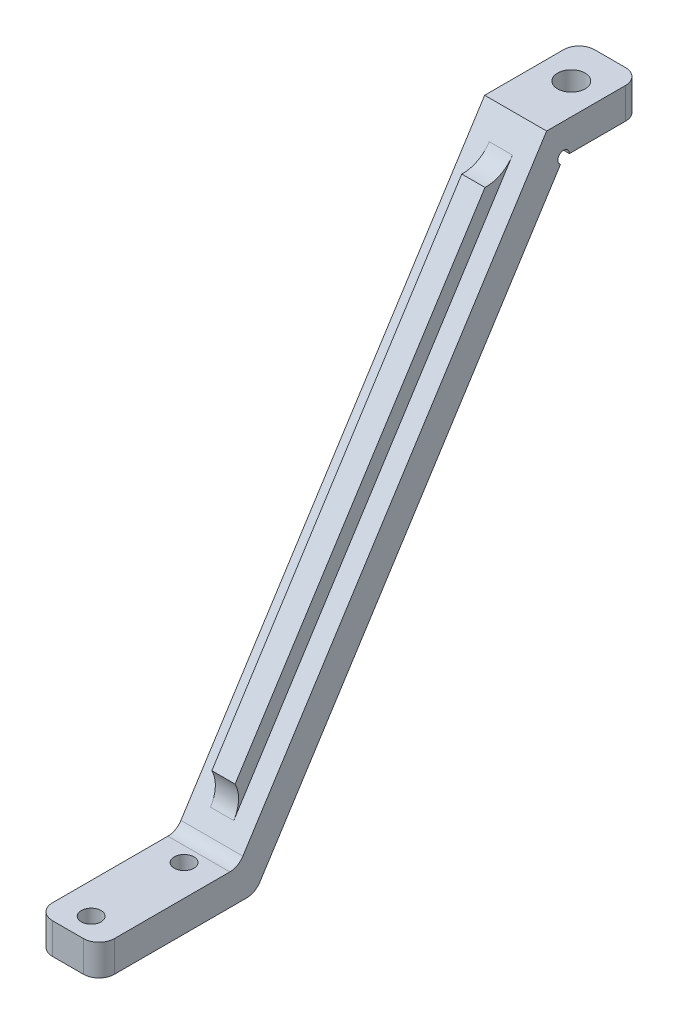
from build123d import *

# Parameters (mm, degrees)
EXTRUDE_1_DEPTH          = 4
CUT_EXTRUDE_1_DEPTH      = 82.325026898
CUT_EXTRUDE_1_DEPTH_BACK = 82.325026898
SKETCH_2_R               = 1.275
CUT_EXTRUDE_2_DEPTH      = 85.433168838
CUT_EXTRUDE_2_DEPTH_BACK = 85.433168838
SKETCH_3_R               = 1.775
EXTRUDE_2_DEPTH          = 1.5
CUT_EXTRUDE_3_DEPTH      = 82.619605488
CUT_EXTRUDE_3_DEPTH_BACK = 82.619605488
SKETCH_5_R               = 0.75
FILLET_2_R               = 4
FILLET_3_R               = 2
FILLET_4_R               = 2


with BuildPart() as part:
    # 草图1 → 凸台-拉伸1 (new, symmetric)
    with BuildSketch(Plane(origin=(0, 0, 0), x_dir=(0, 0, -1), z_dir=(1, 0, 0))):
        Polygon((-18, 0), (0, 0), (39.807123819, 62.4), (52, 62.4), (52, 58.4), (42, 58.4), (2.192876181, -4), (-18, -4), align=None)
    extrude(amount=EXTRUDE_1_DEPTH, both=True)

    # 草图2 → 切除-拉伸1 (cut, two sides: drawn at the far end of the back side and taken through both)
    with BuildSketch(Plane(origin=(0, 0, 0), x_dir=(1, 0, 0), z_dir=(0, 1, 0)).offset(-CUT_EXTRUDE_1_DEPTH_BACK)):
        with Locations(Location((0, -3, 0), (0, 0, 270))):
            Circle(SKETCH_2_R)
        with Locations(Location((0, -15, 0), (0, 0, 270))):
            Circle(SKETCH_2_R)
    extrude(amount=CUT_EXTRUDE_1_DEPTH + CUT_EXTRUDE_1_DEPTH_BACK, mode=Mode.SUBTRACT)

    # 草图3 → 切除-拉伸2 (cut, two sides: drawn at the far end of the back side and taken through both)
    with BuildSketch(Plane(origin=(0, 62.4, 0), x_dir=(1, 0, 0), z_dir=(0, 1, 0)).offset(-CUT_EXTRUDE_2_DEPTH_BACK)):
        with Locations(Location((0, 47, 0), (0, 0, 270))):
            Circle(SKETCH_3_R)
    extrude(amount=CUT_EXTRUDE_2_DEPTH + CUT_EXTRUDE_2_DEPTH_BACK, mode=Mode.SUBTRACT)

    # 草图4 → 凸台-拉伸2 (add, symmetric)
    with BuildSketch(Plane(origin=(0, 0, 0), x_dir=(0, 0, -1), z_dir=(1, 0, 0))):
        Polygon((3.769025595, 5.908168553), (2.082903499, 6.983804308), (34.351976128, 57.567467201), (36.038098224, 56.491831447), align=None)
        Polygon((39.410342417, 54.340559938), (41.096464513, 53.264924184), (8.827391885, 2.681261291), (7.141269788, 3.756897045), align=None)
    extrude(amount=EXTRUDE_2_DEPTH, both=True)

    # 草图5 → 切除-拉伸3 (cut, two sides: drawn at the far end of the back side and taken through both)
    with BuildSketch(Plane(origin=(4, 0, 0), x_dir=(0, 0, -1), z_dir=(1, 0, 0)).offset(-CUT_EXTRUDE_3_DEPTH_BACK)):
        with Locations((42, 58.4)):
            Circle(SKETCH_5_R)
    extrude(amount=CUT_EXTRUDE_3_DEPTH + CUT_EXTRUDE_3_DEPTH_BACK, mode=Mode.SUBTRACT)

    # 圆角2
    # the kernel refuses this fillet: 4 mm, written as the material it adds along each edge
    with BuildSketch(Plane(origin=(-1.5, 3.756897045, -7.141269788), x_dir=(0, -0.8430610482191677, 0.5378178771439251), z_dir=(1, 0, 0)), Plane(origin=(-1.5, 56.491831447, -36.038098224), x_dir=(0, 0.8430610482191674, -0.5378178771439257), z_dir=(1, 0, 0))) as fillet_2_piece_1:
        with BuildLine():
            CenterArc((3.464101615, 4), FILLET_2_R, 210, 60)
            Line((0, 2), (-0.069282032, 1.96))
            ThreePointArc((-0.069282032, 1.96), (-0.08, 1), (-0.08, 0))
            Line((-0.08, 0), (0, -0.08))
            Line((0, -0.08), (3.464101615, -0.08))
            Line((3.464101615, -0.08), (3.464101615, 0))
        make_face()
    extrude(amount=3)
    with BuildSketch(Plane(origin=(-1.5, 5.908168553, -3.769025595), x_dir=(0, -0.8430610482191704, 0.5378178771439209), z_dir=(1, 0, 0)), Plane(origin=(-1.5, 54.340559938, -39.410342417), x_dir=(0, 0.8430610482191698, -0.5378178771439218), z_dir=(1, 0, 0))) as fillet_2_piece_2:
        with BuildLine():
            CenterArc((3.464101615, -4), FILLET_2_R, 90, 60)
            Line((0, -2), (-0.069282032, -1.96))
            ThreePointArc((-0.069282032, -1.96), (-0.08, -1), (-0.08, 0))
            Line((-0.08, 0), (0, 0.08))
            Line((0, 0.08), (3.464101615, 0.08))
            Line((3.464101615, 0.08), (3.464101615, 0))
        make_face()
    extrude(amount=3)

    # 圆角3
    fillet_3_edges = [part.edges().sort_by_distance(p)[0] for p in [
        (-4, -2, 18),
        (4, 60.4, -52),
        (4, -2, 18),
        (-4, 60.4, -52),
    ]]
    fillet(fillet_3_edges, radius=FILLET_3_R)

    # 圆角4
    fillet_4_edges = [part.edges().sort_by_distance(p)[0] for p in [
        (0, 0, 0),
        (0, -4, -2.192876181),
    ]]
    fillet(fillet_4_edges, radius=FILLET_4_R)


solid = part.part
